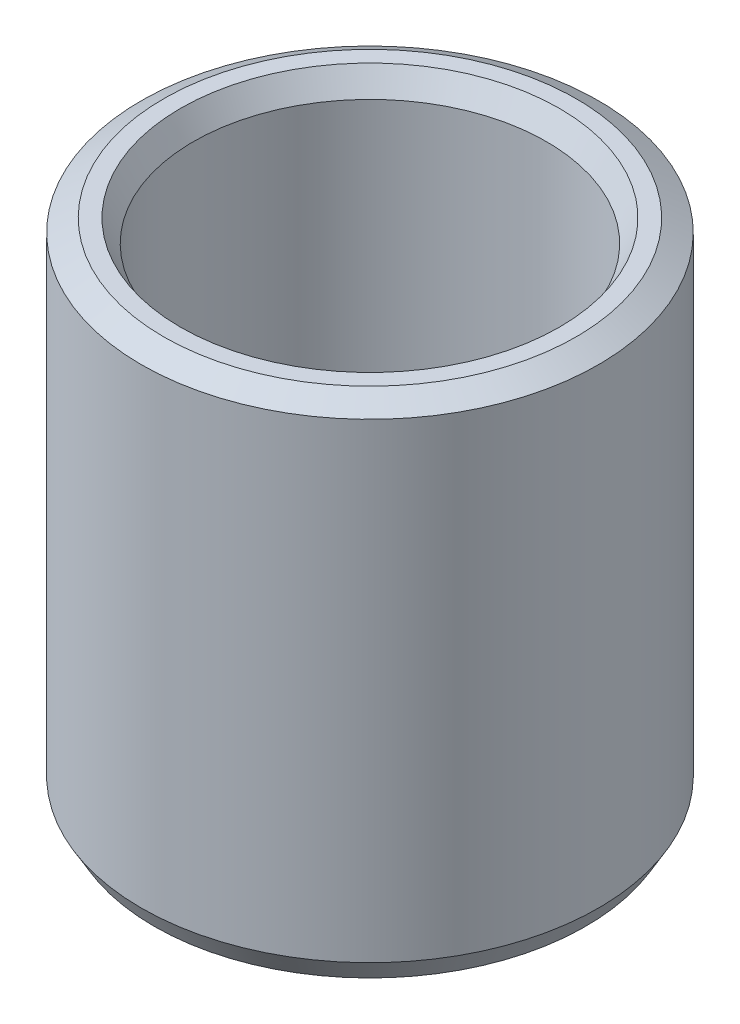
from build123d import *
from OCP.BRepFilletAPI import BRepFilletAPI_MakeChamfer

# Parameters (mm, degrees)
SKETCH1_R           = 50
BOSS_EXTRUDE1_DEPTH = 110.624641813
SKETCH2_R           = 38.62254673
CUT_EXTRUDE1_DEPTH  = 132.292845868
CHAMFER1_SIZE       = 2.821049314
CHAMFER1_SIZE2      = 4.886200743


with BuildPart() as part:
    # Sketch1 → Boss-Extrude1 (new body)
    with BuildSketch(Plane(origin=(0, 0, 0), x_dir=(1, 0, 0), z_dir=(0, 1, 0))):
        Circle(SKETCH1_R)
    extrude(amount=BOSS_EXTRUDE1_DEPTH)

    # Sketch2 → Cut-Extrude1 (cut, through all)
    with BuildSketch(Plane(origin=(0, 0, 0), x_dir=(1, 0, 0), z_dir=(0, 1, 0))):
        Circle(SKETCH2_R)
    extrude(amount=CUT_EXTRUDE1_DEPTH, mode=Mode.SUBTRACT)

    # Chamfer1: one chamfer whose edges measure the first distance from different faces: ONE call of the kernel's chamfer builder (chamfer() names one face for all edges)
    chamfer1_edges_1 = [part.edges().sort_by_distance(p)[0] for p in [
        (-38.62254673, 110.624641813, 0),
    ]]
    chamfer1_side_1 = [part.faces().sort_by_distance(p)[0] for p in [
        (-48.585786438, 110.624641813, 0),
    ]]
    chamfer1_edges_2 = [part.edges().sort_by_distance(p)[0] for p in [
        (-38.62254673, 0, 0),
    ]]
    chamfer1_side_2 = [part.faces().sort_by_distance(p)[0] for p in [
        (-38.62254673, 55.312320906, 0),
    ]]
    chamfer1_edges_3 = [part.edges().sort_by_distance(p)[0] for p in [
        (-50, 0, 0),
    ]]
    chamfer1_side_3 = [part.faces().sort_by_distance(p)[0] for p in [
        (-48.585786438, 0, 0),
    ]]
    chamfer1_edges_4 = [part.edges().sort_by_distance(p)[0] for p in [
        (-50, 110.624641813, 0),
    ]]
    chamfer1_side_4 = [part.faces().sort_by_distance(p)[0] for p in [
        (-50, 55.312320906, 0),
    ]]
    chamfer1 = BRepFilletAPI_MakeChamfer(part.part.solid().wrapped)
    for e in chamfer1_edges_1:
        chamfer1.Add(CHAMFER1_SIZE, CHAMFER1_SIZE2, e.wrapped, chamfer1_side_1[0].wrapped)  # the first distance lies on this face
    for e in chamfer1_edges_2:
        chamfer1.Add(CHAMFER1_SIZE, CHAMFER1_SIZE2, e.wrapped, chamfer1_side_2[0].wrapped)  # the first distance lies on this face
    for e in chamfer1_edges_3:
        chamfer1.Add(CHAMFER1_SIZE, CHAMFER1_SIZE2, e.wrapped, chamfer1_side_3[0].wrapped)  # the first distance lies on this face
    for e in chamfer1_edges_4:
        chamfer1.Add(CHAMFER1_SIZE, CHAMFER1_SIZE2, e.wrapped, chamfer1_side_4[0].wrapped)  # the first distance lies on this face
    add(Compound.cast(chamfer1.Shape()), mode=Mode.REPLACE)


solid = part.part
